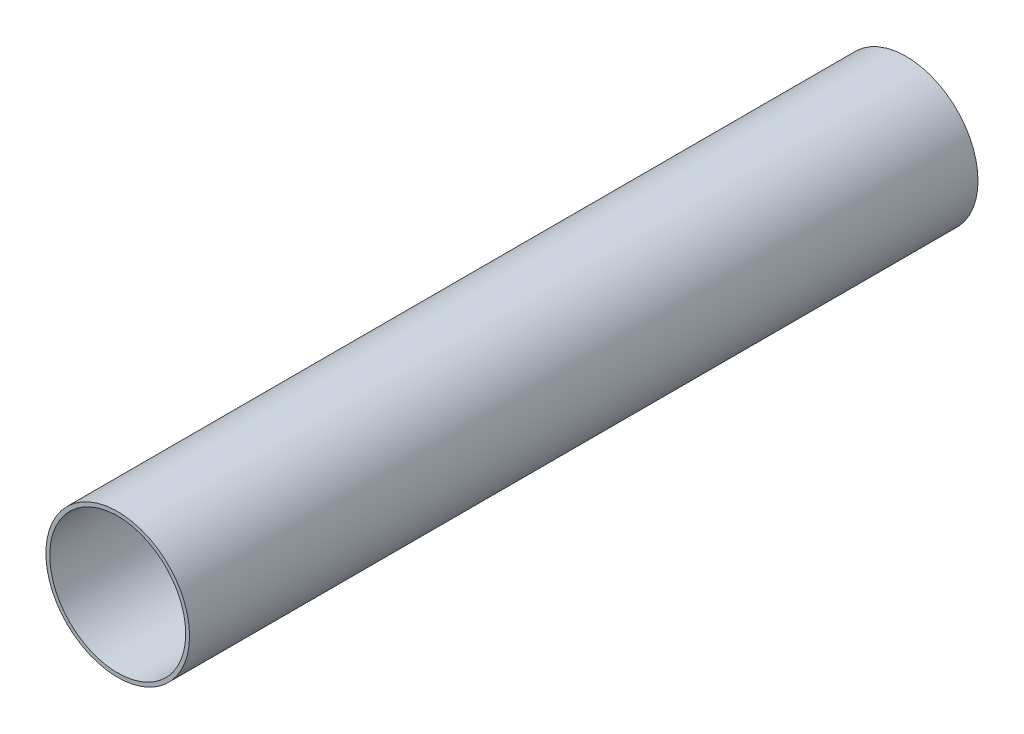
from build123d import *

# Parameters (mm, degrees)
EXTRUDE_THIN1_DEPTH      = 109.22
EXTRUDE_THIN1_DEPTH_BACK = 406.4
SKETCH2_R                = 46.99
SKETCH2_R_2              = 44.45
SKETCH3_R                = 41.275
BOSS_EXTRUDE1_DEPTH      = 2.54
CUT_EXTRUDE_THIN3_START  = -1.27
CUT_EXTRUDE_THIN3_DEPTH  = 1.27


# Read off the part's stored shape, not the designer's step: Cut-Extrude-Thin3
with BuildPart() as part:
    # Sketch2 → Extrude-Thin1 (new, two sides: drawn at the far end of the back side and taken through both)
    with BuildSketch(Plane.XY.offset(-EXTRUDE_THIN1_DEPTH_BACK)):
        Circle(SKETCH2_R)
        Circle(SKETCH2_R_2, mode=Mode.SUBTRACT)
    extrude(amount=EXTRUDE_THIN1_DEPTH + EXTRUDE_THIN1_DEPTH_BACK)


with BuildPart() as body_2:
    # Sketch3 → Boss-Extrude1 (new body)
    with BuildSketch(Plane.XY):
        Circle(SKETCH3_R)
    extrude(amount=BOSS_EXTRUDE1_DEPTH)

    # Cut-Extrude-Thin3 outline → Cut-Extrude-Thin3 (cut)
    with BuildSketch(Plane(origin=(0, 0, 0), x_dir=(-1, 0, 0), z_dir=(0, 0, -1)).offset(CUT_EXTRUDE_THIN3_START)):
        with BuildLine():
            ThreePointArc((14.744179652, -35.687), (15.887179652, -36.83), (14.744179652, -37.973))
            Line((14.744179652, -37.973), (-10.655820348, -37.973))
            Line((-10.655820348, -37.973), (-10.655820348, -38.1))
            Line((-10.655820348, -38.1), (14.744179652, -38.1))
            ThreePointArc((14.744179652, -38.1), (16.014179652, -36.83), (14.744179652, -35.56))
            Line((14.744179652, -35.56), (-10.655820348, -35.56))
            ThreePointArc((-10.655820348, -35.56), (-11.925820348, -34.29), (-10.655820348, -33.02))
            Line((-10.655820348, -33.02), (14.744179652, -33.02))
            ThreePointArc((14.744179652, -33.02), (16.014179652, -31.75), (14.744179652, -30.48))
            Line((14.744179652, -30.48), (-10.655820348, -30.48))
            ThreePointArc((-10.655820348, -30.48), (-11.925820348, -29.21), (-10.655820348, -27.94))
            Line((-10.655820348, -27.94), (14.744179652, -27.94))
            ThreePointArc((14.744179652, -27.94), (16.014179652, -26.67), (14.744179652, -25.4))
            Line((14.744179652, -25.4), (-10.655820348, -25.4))
            ThreePointArc((-10.655820348, -25.4), (-11.925820348, -24.13), (-10.655820348, -22.86))
            Line((-10.655820348, -22.86), (14.744179652, -22.86))
            ThreePointArc((14.744179652, -22.86), (16.014179652, -21.59), (14.744179652, -20.32))
            Line((14.744179652, -20.32), (-10.655820348, -20.32))
            ThreePointArc((-10.655820348, -20.32), (-11.925820348, -19.05), (-10.655820348, -17.78))
            Line((-10.655820348, -17.78), (14.744179652, -17.78))
            ThreePointArc((14.744179652, -17.78), (16.014179652, -16.51), (14.744179652, -15.24))
            Line((14.744179652, -15.24), (2.104328912, -15.24))
            ThreePointArc((2.104328912, -15.24), (0.616343668, -14.623656332), (0, -13.135671088))
            Line((0, -13.135671088), (0, -0.127))
            Line((0, -0.127), (13.135671088, -0.127))
            ThreePointArc((13.135671088, -0.127), (14.713458893, 0.526541107), (15.367, 2.104328912))
            Line((15.367, 2.104328912), (15.367, 14.744179652))
            ThreePointArc((15.367, 14.744179652), (16.51, 15.887179652), (17.653, 14.744179652))
            Line((17.653, 14.744179652), (17.653, -10.655820348))
            ThreePointArc((17.653, -10.655820348), (19.05, -12.052820348), (20.447, -10.655820348))
            Line((20.447, -10.655820348), (20.447, 14.744179652))
            ThreePointArc((20.447, 14.744179652), (21.59, 15.887179652), (22.733, 14.744179652))
            Line((22.733, 14.744179652), (22.733, -10.655820348))
            ThreePointArc((22.733, -10.655820348), (24.13, -12.052820348), (25.527, -10.655820348))
            Line((25.527, -10.655820348), (25.527, 14.744179652))
            ThreePointArc((25.527, 14.744179652), (26.67, 15.887179652), (27.813, 14.744179652))
            Line((27.813, 14.744179652), (27.813, -10.655820348))
            ThreePointArc((27.813, -10.655820348), (29.21, -12.052820348), (30.607, -10.655820348))
            Line((30.607, -10.655820348), (30.607, 14.744179652))
            ThreePointArc((30.607, 14.744179652), (31.75, 15.887179652), (32.893, 14.744179652))
            Line((32.893, 14.744179652), (32.893, -10.655820348))
            ThreePointArc((32.893, -10.655820348), (34.29, -12.052820348), (35.687, -10.655820348))
            Line((35.687, -10.655820348), (35.687, 14.744179652))
            ThreePointArc((35.687, 14.744179652), (36.83, 15.887179652), (37.973, 14.744179652))
            Line((37.973, 14.744179652), (37.973, -10.655820348))
            Line((37.973, -10.655820348), (38.1, -10.655820348))
            Line((38.1, -10.655820348), (38.1, 14.744179652))
            ThreePointArc((38.1, 14.744179652), (36.83, 16.014179652), (35.56, 14.744179652))
            Line((35.56, 14.744179652), (35.56, -10.655820348))
            ThreePointArc((35.56, -10.655820348), (34.29, -11.925820348), (33.02, -10.655820348))
            Line((33.02, -10.655820348), (33.02, 14.744179652))
            ThreePointArc((33.02, 14.744179652), (31.75, 16.014179652), (30.48, 14.744179652))
            Line((30.48, 14.744179652), (30.48, -10.655820348))
            ThreePointArc((30.48, -10.655820348), (29.21, -11.925820348), (27.94, -10.655820348))
            Line((27.94, -10.655820348), (27.94, 14.744179652))
            ThreePointArc((27.94, 14.744179652), (26.67, 16.014179652), (25.4, 14.744179652))
            Line((25.4, 14.744179652), (25.4, -10.655820348))
            ThreePointArc((25.4, -10.655820348), (24.13, -11.925820348), (22.86, -10.655820348))
            Line((22.86, -10.655820348), (22.86, 14.744179652))
            ThreePointArc((22.86, 14.744179652), (21.59, 16.014179652), (20.32, 14.744179652))
            Line((20.32, 14.744179652), (20.32, -10.655820348))
            ThreePointArc((20.32, -10.655820348), (19.05, -11.925820348), (17.78, -10.655820348))
            Line((17.78, -10.655820348), (17.78, 14.744179652))
            ThreePointArc((17.78, 14.744179652), (16.51, 16.014179652), (15.24, 14.744179652))
            Line((15.24, 14.744179652), (15.24, 2.104328912))
            ThreePointArc((15.24, 2.104328912), (14.623656332, 0.616343668), (13.135671088, 0))
            Line((13.135671088, 0), (0.127, 0))
            Line((0.127, 0), (0.127, 13.135671088))
            ThreePointArc((0.127, 13.135671088), (-0.526541107, 14.713458893), (-2.104328912, 15.367))
            Line((-2.104328912, 15.367), (-14.744179652, 15.367))
            ThreePointArc((-14.744179652, 15.367), (-15.887179652, 16.51), (-14.744179652, 17.653))
            Line((-14.744179652, 17.653), (10.655820348, 17.653))
            ThreePointArc((10.655820348, 17.653), (12.052820348, 19.05), (10.655820348, 20.447))
            Line((10.655820348, 20.447), (-14.744179652, 20.447))
            ThreePointArc((-14.744179652, 20.447), (-15.887179652, 21.59), (-14.744179652, 22.733))
            Line((-14.744179652, 22.733), (10.655820348, 22.733))
            ThreePointArc((10.655820348, 22.733), (12.052820348, 24.13), (10.655820348, 25.527))
            Line((10.655820348, 25.527), (-14.744179652, 25.527))
            ThreePointArc((-14.744179652, 25.527), (-15.887179652, 26.67), (-14.744179652, 27.813))
            Line((-14.744179652, 27.813), (10.655820348, 27.813))
            ThreePointArc((10.655820348, 27.813), (12.052820348, 29.21), (10.655820348, 30.607))
            Line((10.655820348, 30.607), (-14.744179652, 30.607))
            ThreePointArc((-14.744179652, 30.607), (-15.887179652, 31.75), (-14.744179652, 32.893))
            Line((-14.744179652, 32.893), (10.655820348, 32.893))
            ThreePointArc((10.655820348, 32.893), (12.052820348, 34.29), (10.655820348, 35.687))
            Line((10.655820348, 35.687), (-14.744179652, 35.687))
            ThreePointArc((-14.744179652, 35.687), (-15.887179652, 36.83), (-14.744179652, 37.973))
            Line((-14.744179652, 37.973), (10.655820348, 37.973))
            Line((10.655820348, 37.973), (10.655820348, 38.1))
            Line((10.655820348, 38.1), (-14.744179652, 38.1))
            ThreePointArc((-14.744179652, 38.1), (-16.014179652, 36.83), (-14.744179652, 35.56))
            Line((-14.744179652, 35.56), (10.655820348, 35.56))
            ThreePointArc((10.655820348, 35.56), (11.925820348, 34.29), (10.655820348, 33.02))
            Line((10.655820348, 33.02), (-14.744179652, 33.02))
            ThreePointArc((-14.744179652, 33.02), (-16.014179652, 31.75), (-14.744179652, 30.48))
            Line((-14.744179652, 30.48), (10.655820348, 30.48))
            ThreePointArc((10.655820348, 30.48), (11.925820348, 29.21), (10.655820348, 27.94))
            Line((10.655820348, 27.94), (-14.744179652, 27.94))
            ThreePointArc((-14.744179652, 27.94), (-16.014179652, 26.67), (-14.744179652, 25.4))
            Line((-14.744179652, 25.4), (10.655820348, 25.4))
            ThreePointArc((10.655820348, 25.4), (11.925820348, 24.13), (10.655820348, 22.86))
            Line((10.655820348, 22.86), (-14.744179652, 22.86))
            ThreePointArc((-14.744179652, 22.86), (-16.014179652, 21.59), (-14.744179652, 20.32))
            Line((-14.744179652, 20.32), (10.655820348, 20.32))
            ThreePointArc((10.655820348, 20.32), (11.925820348, 19.05), (10.655820348, 17.78))
            Line((10.655820348, 17.78), (-14.744179652, 17.78))
            ThreePointArc((-14.744179652, 17.78), (-16.014179652, 16.51), (-14.744179652, 15.24))
            Line((-14.744179652, 15.24), (-2.104328912, 15.24))
            ThreePointArc((-2.104328912, 15.24), (-0.616343668, 14.623656332), (0, 13.135671088))
            Line((0, 13.135671088), (0, 0.127))
            Line((0, 0.127), (-13.135671088, 0.127))
            ThreePointArc((-13.135671088, 0.127), (-14.713458893, -0.526541107), (-15.367, -2.104328912))
            Line((-15.367, -2.104328912), (-15.367, -14.744179652))
            ThreePointArc((-15.367, -14.744179652), (-16.51, -15.887179652), (-17.653, -14.744179652))
            Line((-17.653, -14.744179652), (-17.653, 10.655820348))
            ThreePointArc((-17.653, 10.655820348), (-19.05, 12.052820348), (-20.447, 10.655820348))
            Line((-20.447, 10.655820348), (-20.447, -14.744179652))
            ThreePointArc((-20.447, -14.744179652), (-21.59, -15.887179652), (-22.733, -14.744179652))
            Line((-22.733, -14.744179652), (-22.733, 10.655820348))
            ThreePointArc((-22.733, 10.655820348), (-24.13, 12.052820348), (-25.527, 10.655820348))
            Line((-25.527, 10.655820348), (-25.527, -14.744179652))
            ThreePointArc((-25.527, -14.744179652), (-26.67, -15.887179652), (-27.813, -14.744179652))
            Line((-27.813, -14.744179652), (-27.813, 10.655820348))
            ThreePointArc((-27.813, 10.655820348), (-29.21, 12.052820348), (-30.607, 10.655820348))
            Line((-30.607, 10.655820348), (-30.607, -14.744179652))
            ThreePointArc((-30.607, -14.744179652), (-31.75, -15.887179652), (-32.893, -14.744179652))
            Line((-32.893, -14.744179652), (-32.893, 10.655820348))
            ThreePointArc((-32.893, 10.655820348), (-34.29, 12.052820348), (-35.687, 10.655820348))
            Line((-35.687, 10.655820348), (-35.687, -14.744179652))
            ThreePointArc((-35.687, -14.744179652), (-36.83, -15.887179652), (-37.973, -14.744179652))
            Line((-37.973, -14.744179652), (-37.973, 10.655820348))
            Line((-37.973, 10.655820348), (-38.1, 10.655820348))
            Line((-38.1, 10.655820348), (-38.1, -14.744179652))
            ThreePointArc((-38.1, -14.744179652), (-36.83, -16.014179652), (-35.56, -14.744179652))
            Line((-35.56, -14.744179652), (-35.56, 10.655820348))
            ThreePointArc((-35.56, 10.655820348), (-34.29, 11.925820348), (-33.02, 10.655820348))
            Line((-33.02, 10.655820348), (-33.02, -14.744179652))
            ThreePointArc((-33.02, -14.744179652), (-31.75, -16.014179652), (-30.48, -14.744179652))
            Line((-30.48, -14.744179652), (-30.48, 10.655820348))
            ThreePointArc((-30.48, 10.655820348), (-29.21, 11.925820348), (-27.94, 10.655820348))
            Line((-27.94, 10.655820348), (-27.94, -14.744179652))
            ThreePointArc((-27.94, -14.744179652), (-26.67, -16.014179652), (-25.4, -14.744179652))
            Line((-25.4, -14.744179652), (-25.4, 10.655820348))
            ThreePointArc((-25.4, 10.655820348), (-24.13, 11.925820348), (-22.86, 10.655820348))
            Line((-22.86, 10.655820348), (-22.86, -14.744179652))
            ThreePointArc((-22.86, -14.744179652), (-21.59, -16.014179652), (-20.32, -14.744179652))
            Line((-20.32, -14.744179652), (-20.32, 10.655820348))
            ThreePointArc((-20.32, 10.655820348), (-19.05, 11.925820348), (-17.78, 10.655820348))
            Line((-17.78, 10.655820348), (-17.78, -14.744179652))
            ThreePointArc((-17.78, -14.744179652), (-16.51, -16.014179652), (-15.24, -14.744179652))
            Line((-15.24, -14.744179652), (-15.24, -2.104328912))
            ThreePointArc((-15.24, -2.104328912), (-14.623656332, -0.616343668), (-13.135671088, 0))
            Line((-13.135671088, 0), (-0.127, 0))
            Line((-0.127, 0), (-0.127, -13.135671088))
            ThreePointArc((-0.127, -13.135671088), (0.526541107, -14.713458893), (2.104328912, -15.367))
            Line((2.104328912, -15.367), (14.744179652, -15.367))
            ThreePointArc((14.744179652, -15.367), (15.887179652, -16.51), (14.744179652, -17.653))
            Line((14.744179652, -17.653), (-10.655820348, -17.653))
            ThreePointArc((-10.655820348, -17.653), (-12.052820348, -19.05), (-10.655820348, -20.447))
            Line((-10.655820348, -20.447), (14.744179652, -20.447))
            ThreePointArc((14.744179652, -20.447), (15.887179652, -21.59), (14.744179652, -22.733))
            Line((14.744179652, -22.733), (-10.655820348, -22.733))
            ThreePointArc((-10.655820348, -22.733), (-12.052820348, -24.13), (-10.655820348, -25.527))
            Line((-10.655820348, -25.527), (14.744179652, -25.527))
            ThreePointArc((14.744179652, -25.527), (15.887179652, -26.67), (14.744179652, -27.813))
            Line((14.744179652, -27.813), (-10.655820348, -27.813))
            ThreePointArc((-10.655820348, -27.813), (-12.052820348, -29.21), (-10.655820348, -30.607))
            Line((-10.655820348, -30.607), (14.744179652, -30.607))
            ThreePointArc((14.744179652, -30.607), (15.887179652, -31.75), (14.744179652, -32.893))
            Line((14.744179652, -32.893), (-10.655820348, -32.893))
            ThreePointArc((-10.655820348, -32.893), (-12.052820348, -34.29), (-10.655820348, -35.687))
            Line((-10.655820348, -35.687), (14.744179652, -35.687))
        make_face()
    extrude(amount=CUT_EXTRUDE_THIN3_DEPTH, mode=Mode.SUBTRACT)


solid = Compound([part.part, body_2.part])
